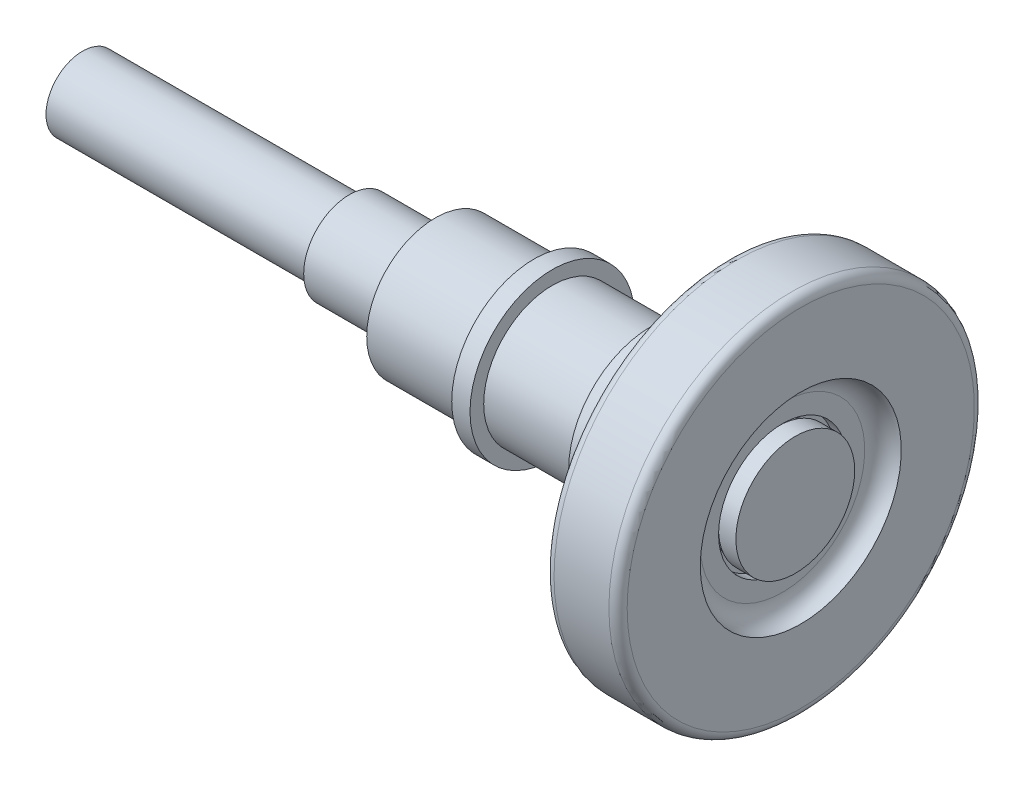
from build123d import *

# Parameters (mm, degrees)
FILLET_1_R      = 5
FILLET_2_R      = 10
SKETCH_2_R      = 45
SKETCH_2_R_2    = 35
EXTRUDE_1_DEPTH = 32
SKETCH_3_R      = 35
EXTRUDE_2_DEPTH = 66
SKETCH_4_R      = 37.5
EXTRUDE_3_DEPTH = 54
SKETCH_5_R      = 45
EXTRUDE_4_DEPTH = 10
SKETCH_6_R      = 37.5
EXTRUDE_5_DEPTH = 54
SKETCH_7_R      = 25
EXTRUDE_6_DEPTH = 47
SKETCH_8_R      = 20
EXTRUDE_7_DEPTH = 146
SKETCH_9_R      = 31
EXTRUDE_8_DEPTH = 3.5
SKETCH_10_R     = 32.5
EXTRUDE_9_DEPTH = 9.5


with BuildPart() as part:
    # 草图1 → 旋转1 (revolve)
    with BuildSketch(Plane.XY, mode=Mode.PRIVATE) as revolve_1_sk:
        Polygon((10, 100), (50, 100), (50, 55), (40, 55), (40, 35), (0, 35), (0, 70), (10, 70), align=None)
    revolve(revolve_1_sk.sketch.rotate(Axis((-1000, 0, 0), (1, 0, 0)), 90), axis=Axis((-1000, 0, 0), (1, 0, 0)))

    # 圆角1
    fillet_1_edges = [part.edges().sort_by_distance(p)[0] for p in [
        (10, 0, -70),
        (50, 0, -100),
        (10, 0, -100),
    ]]
    fillet(fillet_1_edges, radius=FILLET_1_R)

    # 圆角2
    fillet_2_edges = [part.edges().sort_by_distance(p)[0] for p in [
        (40, 0, -55),
    ]]
    fillet(fillet_2_edges, radius=FILLET_2_R - 0.0001)  # a hair under: the kernel refuses the full size



with BuildPart() as body_2:
    # 草图2 → 凸台-拉伸1 (new body)
    with BuildSketch(Plane.ZY):
        Circle(SKETCH_2_R)
        Circle(SKETCH_2_R_2, mode=Mode.SUBTRACT)
    extrude(amount=EXTRUDE_1_DEPTH)


with BuildPart() as part_1:
    add(part.part)

    add(body_2.part)  # 凸台-拉伸2 merges body 2
    # 草图3 → 凸台-拉伸2 (add)
    with BuildSketch(Plane.ZY.offset(32)):
        Circle(SKETCH_3_R)
    extrude(amount=-EXTRUDE_2_DEPTH)

    # 草图4 → 凸台-拉伸3 (add)
    with BuildSketch(Plane.ZY.offset(32)):
        Circle(SKETCH_4_R)
    extrude(amount=EXTRUDE_3_DEPTH)

    # 草图5 → 凸台-拉伸4 (add)
    with BuildSketch(Plane.ZY.offset(86)):
        with Locations(Location((0, 0, 0), (0, 0, 180))):
            Circle(SKETCH_5_R)
    extrude(amount=EXTRUDE_4_DEPTH)

    # 草图6 → 凸台-拉伸5 (add)
    with BuildSketch(Plane.ZY.offset(96)):
        Circle(SKETCH_6_R)
    extrude(amount=EXTRUDE_5_DEPTH)

    # 草图7 → 凸台-拉伸6 (add)
    with BuildSketch(Plane.ZY.offset(150)):
        Circle(SKETCH_7_R)
    extrude(amount=EXTRUDE_6_DEPTH)

    # 草图8 → 凸台-拉伸7 (add)
    with BuildSketch(Plane.ZY.offset(197)):
        Circle(SKETCH_8_R)
    extrude(amount=EXTRUDE_7_DEPTH)

    # 草图9 → 凸台-拉伸8 (add)
    with BuildSketch(Plane(origin=(34, 0, 0), x_dir=(0, 0, -1), z_dir=(1, 0, 0))):
        with Locations(Location((0, 0, 0), (0, 0, 180))):
            Circle(SKETCH_9_R)
    extrude(amount=EXTRUDE_8_DEPTH)

    # 草图10 → 凸台-拉伸9 (add)
    with BuildSketch(Plane(origin=(37.5, 0, 0), x_dir=(0, 0, -1), z_dir=(1, 0, 0))):
        Circle(SKETCH_10_R)
    extrude(amount=EXTRUDE_9_DEPTH)


solid = part_1.part
